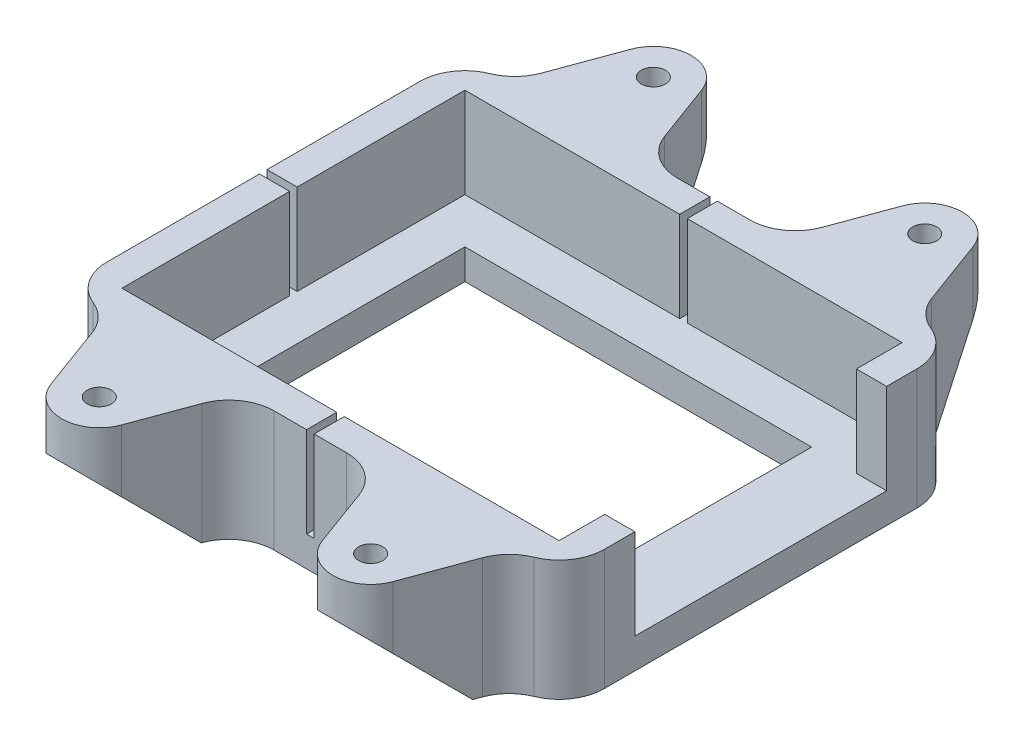
from build123d import *

# Parameters (mm, degrees)
SKETCH_1_W            = 66
SKETCH_1_H            = 53.5
SKETCH_1_W_2          = 58
SKETCH_1_H_2          = 45.5
SKETCH_1_W_3          = 46
SKETCH_1_H_3          = 33.5
EXTRUDE_1_DEPTH       = 4
EXTRUDE_START         = 4
SKETCH_1_4_W          = 66
SKETCH_1_4_H          = 53.5
SKETCH_1_4_W_2        = 58
SKETCH_1_4_H_2        = 45.5
EXTRUDE_2_DEPTH       = 12
SKETCH_2_R            = 1.6
EXTRUDE_3_DEPTH       = 5
CHAMFER_1_OUTLINE_R   = 1.6
CHAMFER_1_DEPTH       = 11
CHAMFER_START         = -14
CHAMFER_1_2_OUTLINE_W = 54
CHAMFER_1_2_OUTLINE_H = 60.830212793
CHAMFER_1_2_DEPTH     = 8.343145751
CHAMFER_START_2       = 35.001785669
CHAMFER_1_3_OUTLINE_W = 54
CHAMFER_1_3_OUTLINE_H = 8.169787207
CHAMFER_1_3_DEPTH     = 18.384776311
SKETCH_4_R            = 3.3
CUT_EXTRUDE_1_DEPTH   = 11
SKETCH_5_W            = 1
SKETCH_5_H            = 4
SKETCH_5_W_2          = 4
SKETCH_5_H_2          = 1
CUT_EXTRUDE_1_2_DEPTH = 12
FILLET_1_R            = 6
FILLET_2_R            = 6
SKETCH_6_W            = 33.396299262
SKETCH_6_H            = 12
CUT_EXTRUDE_2_DEPTH   = 8


with BuildPart() as part:
    # 草图1 → 凸台-拉伸1 (new body)
    # profile 1 of 2: a face of its own
    with BuildSketch(Plane(origin=(0, 0, 0), x_dir=(1, 0, 0), z_dir=(0, 1, 0))):
        with Locations((0, 22.75)):
            Rectangle(SKETCH_1_W, SKETCH_1_H)
        with Locations((0, 22.75)):
            Rectangle(SKETCH_1_W_2, SKETCH_1_H_2, mode=Mode.SUBTRACT)
    # profile 2 of 2: a face of its own
    with BuildSketch(Plane(origin=(0, 0, 0), x_dir=(1, 0, 0), z_dir=(0, 1, 0))):
        with Locations((0, 22.75)):
            Rectangle(SKETCH_1_W_2, SKETCH_1_H_2)
        with Locations((0, 22.75)):
            Rectangle(SKETCH_1_W_3, SKETCH_1_H_3, mode=Mode.SUBTRACT)
    extrude(amount=EXTRUDE_1_DEPTH)

    # 草图1<4> → 凸台-拉伸2 (add)
    with BuildSketch(Plane(origin=(0, 0, 0), x_dir=(1, 0, 0), z_dir=(0, 1, 0)).offset(EXTRUDE_START)):
        with Locations((0, 22.75)):
            Rectangle(SKETCH_1_4_W, SKETCH_1_4_H)
        with Locations((0, 22.75)):
            Rectangle(SKETCH_1_4_W_2, SKETCH_1_4_H_2, mode=Mode.SUBTRACT)
    extrude(amount=EXTRUDE_2_DEPTH)

    # 草图2 → 凸台-拉伸3 (add)
    # profile 1 of 4: a face of its own
    with BuildSketch(Plane(origin=(0, 16, 0), x_dir=(1, 0, 0), z_dir=(0, 1, 0))):
        with BuildLine():
            Line((13.30663094, 61.224032154), (9, 49.5))
            Line((9, 49.5), (27, 49.5))
            Line((27, 49.5), (22.69336906, 61.224032154))
            ThreePointArc((22.69336906, 61.224032154), (18, 64.5), (13.30663094, 61.224032154))
        make_face()
        with Locations(Location((18, 59.5, 0), (0, 0, 270))):
            Circle(SKETCH_2_R, mode=Mode.SUBTRACT)
    # profile 2 of 4: a face of its own
    with BuildSketch(Plane(origin=(0, 16, 0), x_dir=(1, 0, 0), z_dir=(0, 1, 0))):
        with BuildLine():
            Line((-27, 49.5), (-22.69336906, 61.224032154))
            ThreePointArc((-22.69336906, 61.224032154), (-18, 64.5), (-13.30663094, 61.224032154))
            Line((-13.30663094, 61.224032154), (-9, 49.5))
            Line((-9, 49.5), (-27, 49.5))
        make_face()
        with Locations(Location((-18, 59.5, 0), (0, 0, 90))):
            Circle(SKETCH_2_R, mode=Mode.SUBTRACT)
    # profile 3 of 4: a face of its own
    with BuildSketch(Plane(origin=(0, 16, 0), x_dir=(1, 0, 0), z_dir=(0, 1, 0))):
        with BuildLine():
            Line((-13.30663094, -15.724032154), (-9, -4))
            Line((-9, -4), (-27, -4))
            Line((-27, -4), (-22.69336906, -15.724032154))
            ThreePointArc((-22.69336906, -15.724032154), (-18, -19), (-13.30663094, -15.724032154))
        make_face()
        with Locations(Location((-18, -14, 0), (0, 0, 270))):
            Circle(SKETCH_2_R, mode=Mode.SUBTRACT)
    # profile 4 of 4: a face of its own
    with BuildSketch(Plane(origin=(0, 16, 0), x_dir=(1, 0, 0), z_dir=(0, 1, 0))):
        with BuildLine():
            Line((27, -4), (22.69336906, -15.724032154))
            ThreePointArc((22.69336906, -15.724032154), (18, -19), (13.30663094, -15.724032154))
            Line((13.30663094, -15.724032154), (9, -4))
            Line((9, -4), (27, -4))
        make_face()
        with Locations(Location((18, -14, 0), (0, 0, 90))):
            Circle(SKETCH_2_R, mode=Mode.SUBTRACT)
    extrude(amount=-EXTRUDE_3_DEPTH)

    # 倒角1: read off the stored shape, not the designer's step
    # 倒角1 outline → 倒角1 (add)
    # profile 1 of 4: a face of its own
    with BuildSketch(Plane(origin=(0, 0, 0), x_dir=(1, 0, 0), z_dir=(0, 1, 0))):
        with BuildLine():
            Line((9, 49.5), (27, 49.5))
            Line((27, 49.5), (22.69336906, 61.224032154))
            ThreePointArc((22.69336906, 61.224032154), (18, 64.5), (13.30663094, 61.224032154))
            Line((13.30663094, 61.224032154), (9, 49.5))
        make_face()
        with Locations((18, 59.5)):
            Circle(CHAMFER_1_OUTLINE_R, mode=Mode.SUBTRACT)
    # profile 2 of 4: a face of its own
    with BuildSketch(Plane(origin=(0, 0, 0), x_dir=(1, 0, 0), z_dir=(0, 1, 0))):
        with BuildLine():
            Line((-27, 49.5), (-9, 49.5))
            Line((-9, 49.5), (-13.30663094, 61.224032154))
            ThreePointArc((-13.30663094, 61.224032154), (-18, 64.5), (-22.69336906, 61.224032154))
            Line((-22.69336906, 61.224032154), (-27, 49.5))
        make_face()
        with Locations((-18, 59.5)):
            Circle(CHAMFER_1_OUTLINE_R, mode=Mode.SUBTRACT)
    # profile 3 of 4: a face of its own
    with BuildSketch(Plane(origin=(0, 0, 0), x_dir=(1, 0, 0), z_dir=(0, 1, 0))):
        with BuildLine():
            Line((-27, -4), (-22.69336906, -15.724032154))
            ThreePointArc((-22.69336906, -15.724032154), (-18, -19), (-13.30663094, -15.724032154))
            Line((-13.30663094, -15.724032154), (-9, -4))
            Line((-9, -4), (-27, -4))
        make_face()
        with Locations((-18, -14)):
            Circle(CHAMFER_1_OUTLINE_R, mode=Mode.SUBTRACT)
    # profile 4 of 4: a face of its own
    with BuildSketch(Plane(origin=(0, 0, 0), x_dir=(1, 0, 0), z_dir=(0, 1, 0))):
        with BuildLine():
            Line((27, -4), (9, -4))
            Line((9, -4), (13.30663094, -15.724032154))
            ThreePointArc((13.30663094, -15.724032154), (18, -19), (22.69336906, -15.724032154))
            Line((22.69336906, -15.724032154), (27, -4))
        make_face()
        with Locations((18, -14)):
            Circle(CHAMFER_1_OUTLINE_R, mode=Mode.SUBTRACT)
    extrude(amount=CHAMFER_1_DEPTH)

    # Chamfer 1 2 outline → Chamfer 1 2 (cut)
    with BuildSketch(Plane(origin=(0, 0, 0), x_dir=(1, 0, 0), z_dir=(0, 0.707106781186544, -0.707106781186551)).offset(CHAMFER_START)):
        with Locations((0, 7.415106397)):
            Rectangle(CHAMFER_1_2_OUTLINE_W, CHAMFER_1_2_OUTLINE_H)
    extrude(amount=CHAMFER_1_2_DEPTH, mode=Mode.SUBTRACT)

    # Chamfer 1 3 outline → Chamfer 1 3 (cut)
    with BuildSketch(Plane(origin=(0, 0, 0), x_dir=(1, 0, 0), z_dir=(0, 0.707106781186544, -0.707106781186551)).offset(CHAMFER_START_2)):
        with Locations((0, 41.915106397)):
            Rectangle(CHAMFER_1_3_OUTLINE_W, CHAMFER_1_3_OUTLINE_H)
    extrude(amount=CHAMFER_1_3_DEPTH, mode=Mode.SUBTRACT)

    # 草图4 → Cut-Extrude 1 (cut)
    with BuildSketch(Plane.XZ):
        with Locations(Location((-18, 14, 0), (0, 0, 270))):
            Circle(SKETCH_4_R)
        with Locations(Location((18, 14, 0), (0, 0, 270))):
            Circle(SKETCH_4_R)
        with Locations(Location((18, -59.5, 0), (0, 0, 270))):
            Circle(SKETCH_4_R)
        with Locations(Location((-18, -59.5, 0), (0, 0, 270))):
            Circle(SKETCH_4_R)
    extrude(amount=-CUT_EXTRUDE_1_DEPTH, mode=Mode.SUBTRACT)

    # 草图5 → Cut-Extrude 1 2 (cut)
    with BuildSketch(Plane(origin=(0, 16, 0), x_dir=(1, 0, 0), z_dir=(0, 1, 0))):
        with Locations((0, 47.5)):
            Rectangle(SKETCH_5_W, SKETCH_5_H)
        with Locations((31, 22.75)):
            Rectangle(SKETCH_5_W_2, SKETCH_5_H_2)
        with Locations((0, -2)):
            Rectangle(SKETCH_5_W, SKETCH_5_H)
        with Locations((-31, 22.75)):
            Rectangle(SKETCH_5_W_2, SKETCH_5_H_2)
    extrude(amount=-CUT_EXTRUDE_1_2_DEPTH, mode=Mode.SUBTRACT)

    # 圆角1
    fillet_1_edges = [part.edges().sort_by_distance(p)[0] for p in [
        (-33, 8, -49.5),
        (-33, 8, 4),
        (33, 8, -49.5),
        (33, 8, 4),
    ]]
    fillet(fillet_1_edges, radius=FILLET_1_R - 0.0001)  # a hair under: the kernel refuses the full size

    # 圆角2
    fillet_2_edges = [part.edges().sort_by_distance(p)[0] for p in [
        (27, 5.5, -49.5),
        (9, 5.5, -49.5),
        (-9, 5.5, -49.5),
        (-27, 5.5, -49.5),
        (-27, 5.5, 4),
        (-9, 5.5, 4),
        (9, 5.5, 4),
        (27, 5.5, 4),
    ]]
    fillet(fillet_2_edges, radius=FILLET_2_R)

    # 草图6 → 切除-拉伸2 (cut)
    with BuildSketch(Plane(origin=(33, 0, 0), x_dir=(0, 0, -1), z_dir=(1, 0, 0))):
        with Locations((22.75, 10)):
            Rectangle(SKETCH_6_W, SKETCH_6_H)
    extrude(amount=-CUT_EXTRUDE_2_DEPTH, mode=Mode.SUBTRACT)


solid = part.part
